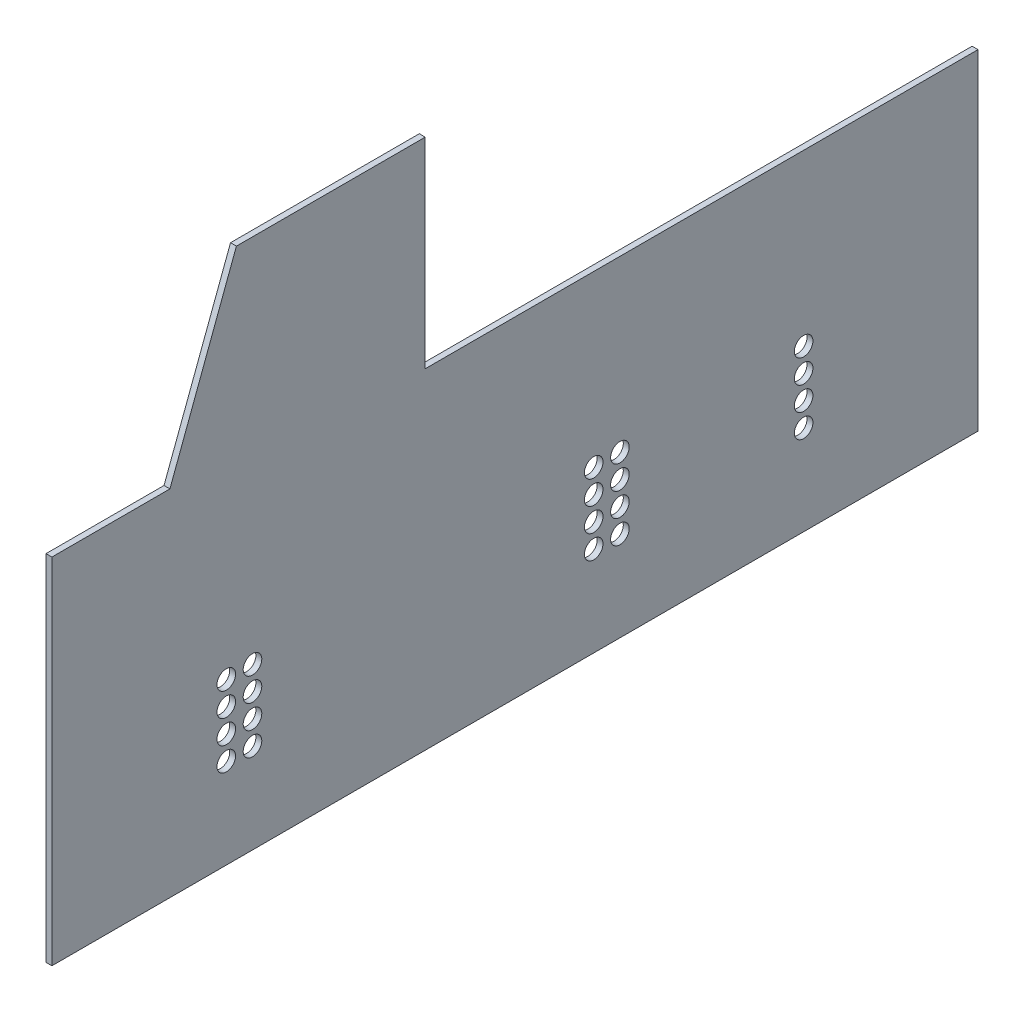
from build123d import *

# Parameters (mm, degrees)
SKETCH1_W                  = 498.348
SKETCH1_H                  = 177.8
BOSS_EXTRUDE1_DEPTH        = 1.5875
BOSS_EXTRUDE2_DEPTH        = 3.175
SKETCH3_R                  = 5
CUT_EXTRUDE3_DEPTH         = 318.565245896
LPATTERN3_COUNT            = 3
LPATTERN3_PITCH            = 12.7
LPATTERN3_COUNT_DIR2       = 2
LPATTERN3_PITCH_DIR2       = 12.7
LPATTERN4_COPY_1_SKETCH_R  = 5
LPATTERN4_COPY_1_DEPTH     = 318.565245896
LPATTERN4_COPY_2_SKETCH_R  = 5
LPATTERN4_COPY_2_DEPTH     = 318.565245896
LPATTERN4_COPY_3_SKETCH_R  = 5
LPATTERN4_COPY_3_DEPTH     = 318.565245896
LPATTERN4_COPY_4_SKETCH_R  = 5
LPATTERN4_COPY_4_DEPTH     = 318.565245896
LPATTERN4_COPY_5_SKETCH_R  = 5
LPATTERN4_COPY_5_DEPTH     = 318.565245896
LPATTERN4_COPY_6_SKETCH_R  = 5
LPATTERN4_COPY_6_DEPTH     = 318.565245896
SKETCH5_R                  = 5
CUT_EXTRUDE4_DEPTH         = 318.565245896
LPATTERN5_COUNT            = 3
LPATTERN5_PITCH            = 12.7
LPATTERN5_COUNT_DIR2       = 2
LPATTERN5_PITCH_DIR2       = 12.7
LPATTERN6_COPY_1_SKETCH_R  = 5
LPATTERN6_COPY_1_DEPTH     = 318.565245896
LPATTERN6_COPY_2_SKETCH_R  = 5
LPATTERN6_COPY_2_DEPTH     = 318.565245896
LPATTERN6_COPY_3_SKETCH_R  = 5
LPATTERN6_COPY_3_DEPTH     = 318.565245896
LPATTERN6_COPY_4_SKETCH_R  = 5
LPATTERN6_COPY_4_DEPTH     = 318.565245896
LPATTERN6_COPY_5_SKETCH_R  = 5
LPATTERN6_COPY_5_DEPTH     = 318.565245896
LPATTERN6_COPY_6_SKETCH_R  = 5
LPATTERN6_COPY_6_DEPTH     = 318.565245896
LPATTERN6_COPY_7_SKETCH_R  = 5
LPATTERN6_COPY_7_DEPTH     = 318.565245896
LPATTERN6_COPY_8_SKETCH_R  = 5
LPATTERN6_COPY_8_DEPTH     = 318.565245896
LPATTERN6_COPY_9_SKETCH_R  = 5
LPATTERN6_COPY_9_DEPTH     = 318.565245896
LPATTERN6_COPY_10_SKETCH_R = 5
LPATTERN6_COPY_10_DEPTH    = 318.565245896
LPATTERN6_COPY_11_SKETCH_R = 5
LPATTERN6_COPY_11_DEPTH    = 318.565245896
LPATTERN6_COPY_12_SKETCH_R = 5
LPATTERN6_COPY_12_DEPTH    = 318.565245896


with BuildPart() as part:
    # Sketch1 → Boss-Extrude1 (new, symmetric)
    with BuildSketch(Plane(origin=(0, 0, 0), x_dir=(0, 0, -1), z_dir=(1, 0, 0))):
        Rectangle(SKETCH1_W, SKETCH1_H)
    extrude(amount=BOSS_EXTRUDE1_DEPTH, both=True)

    # Sketch2 → Boss-Extrude2 (add)
    with BuildSketch(Plane.ZY.offset(1.5875)):
        Polygon((48.2854, 196.85), (48.2854, 88.9), (249.174, 88.9), (249.174, 101.6), (185.674, 101.6), (149.8854, 196.85), align=None)
    extrude(amount=-BOSS_EXTRUDE2_DEPTH)

    # Sketch3 → Cut-Extrude3 (cut, through all)
    with BuildSketch(Plane.ZY.offset(1.5875)):
        with Locations((155.3337, -27.7749)):
            Circle(SKETCH3_R)
    cut_extrude3 = extrude(amount=-CUT_EXTRUDE3_DEPTH, mode=Mode.SUBTRACT)

    # LPattern3: Cut-Extrude3 3 × 2
    with Locations(*[Vector(0, 1, 0) * (i * LPATTERN3_PITCH) + Vector(0, -1, 0) * (j * LPATTERN3_PITCH_DIR2) for i in range(LPATTERN3_COUNT) for j in range(LPATTERN3_COUNT_DIR2) if (i, j) != (0, 0)]):
        add(cut_extrude3, mode=Mode.SUBTRACT)

    # LPattern4 copy 1 sketch → LPattern4 copy 1 (cut, through all)
    with BuildSketch(Plane(origin=(-1.5875, -12.7, -197.7136), x_dir=(0, 0, 1), z_dir=(-1, 0, 0))):
        with Locations((155.3337, -27.7749)):
            Circle(LPATTERN4_COPY_1_SKETCH_R)
    extrude(amount=-LPATTERN4_COPY_1_DEPTH, mode=Mode.SUBTRACT)

    # LPattern4 copy 2 sketch → LPattern4 copy 2 (cut, through all)
    with BuildSketch(Plane(origin=(-1.5875, 12.7, -197.7136), x_dir=(0, 0, 1), z_dir=(-1, 0, 0))):
        with Locations((155.3337, -27.7749)):
            Circle(LPATTERN4_COPY_2_SKETCH_R)
    extrude(amount=-LPATTERN4_COPY_2_DEPTH, mode=Mode.SUBTRACT)

    # LPattern4 copy 3 sketch → LPattern4 copy 3 (cut, through all)
    with BuildSketch(Plane(origin=(-1.5875, 0, -197.7136), x_dir=(0, 0, 1), z_dir=(-1, 0, 0))):
        with Locations((155.3337, -27.7749)):
            Circle(LPATTERN4_COPY_3_SKETCH_R)
    extrude(amount=-LPATTERN4_COPY_3_DEPTH, mode=Mode.SUBTRACT)

    # LPattern4 copy 4 sketch → LPattern4 copy 4 (cut, through all)
    with BuildSketch(Plane(origin=(-1.5875, 25.4, -197.7136), x_dir=(0, 0, 1), z_dir=(-1, 0, 0))):
        with Locations((155.3337, -27.7749)):
            Circle(LPATTERN4_COPY_4_SKETCH_R)
    extrude(amount=-LPATTERN4_COPY_4_DEPTH, mode=Mode.SUBTRACT)

    # LPattern4 copy 5 sketch → LPattern4 copy 5 (cut, through all)
    with BuildSketch(Plane(origin=(-1.5875, 12.7, -197.7136), x_dir=(0, 0, 1), z_dir=(-1, 0, 0))):
        with Locations((155.3337, -27.7749)):
            Circle(LPATTERN4_COPY_5_SKETCH_R)
    extrude(amount=-LPATTERN4_COPY_5_DEPTH, mode=Mode.SUBTRACT)

    # LPattern4 copy 6 sketch → LPattern4 copy 6 (cut, through all)
    with BuildSketch(Plane(origin=(-1.5875, 0, -197.7136), x_dir=(0, 0, 1), z_dir=(-1, 0, 0))):
        with Locations((155.3337, -27.7749)):
            Circle(LPATTERN4_COPY_6_SKETCH_R)
    extrude(amount=-LPATTERN4_COPY_6_DEPTH, mode=Mode.SUBTRACT)

    # Sketch5 → Cut-Extrude4 (cut, through all)
    with BuildSketch(Plane.ZY.offset(1.5875)):
        with Locations((141.2367, -27.7749)):
            Circle(SKETCH5_R)
    cut_extrude4 = extrude(amount=-CUT_EXTRUDE4_DEPTH, mode=Mode.SUBTRACT)

    # LPattern5: Cut-Extrude4 3 × 2
    with Locations(*[Vector(0, 1, 0) * (i * LPATTERN5_PITCH) + Vector(0, -1, 0) * (j * LPATTERN5_PITCH_DIR2) for i in range(LPATTERN5_COUNT) for j in range(LPATTERN5_COUNT_DIR2) if (i, j) != (0, 0)]):
        add(cut_extrude4, mode=Mode.SUBTRACT)

    # LPattern6 copy 1 sketch → LPattern6 copy 1 (cut, through all)
    with BuildSketch(Plane(origin=(-1.5875, -12.7, -197.7136), x_dir=(0, 0, 1), z_dir=(-1, 0, 0))):
        with Locations((141.2367, -27.7749)):
            Circle(LPATTERN6_COPY_1_SKETCH_R)
    extrude(amount=-LPATTERN6_COPY_1_DEPTH, mode=Mode.SUBTRACT)

    # LPattern6 copy 2 sketch → LPattern6 copy 2 (cut, through all)
    with BuildSketch(Plane(origin=(-1.5875, -12.7, -296.5704), x_dir=(0, 0, 1), z_dir=(-1, 0, 0))):
        with Locations((141.2367, -27.7749)):
            Circle(LPATTERN6_COPY_2_SKETCH_R)
    extrude(amount=-LPATTERN6_COPY_2_DEPTH, mode=Mode.SUBTRACT)

    # LPattern6 copy 3 sketch → LPattern6 copy 3 (cut, through all)
    with BuildSketch(Plane(origin=(-1.5875, 12.7, -197.7136), x_dir=(0, 0, 1), z_dir=(-1, 0, 0))):
        with Locations((141.2367, -27.7749)):
            Circle(LPATTERN6_COPY_3_SKETCH_R)
    extrude(amount=-LPATTERN6_COPY_3_DEPTH, mode=Mode.SUBTRACT)

    # LPattern6 copy 4 sketch → LPattern6 copy 4 (cut, through all)
    with BuildSketch(Plane(origin=(-1.5875, 12.7, -296.5704), x_dir=(0, 0, 1), z_dir=(-1, 0, 0))):
        with Locations((141.2367, -27.7749)):
            Circle(LPATTERN6_COPY_4_SKETCH_R)
    extrude(amount=-LPATTERN6_COPY_4_DEPTH, mode=Mode.SUBTRACT)

    # LPattern6 copy 5 sketch → LPattern6 copy 5 (cut, through all)
    with BuildSketch(Plane(origin=(-1.5875, 0, -197.7136), x_dir=(0, 0, 1), z_dir=(-1, 0, 0))):
        with Locations((141.2367, -27.7749)):
            Circle(LPATTERN6_COPY_5_SKETCH_R)
    extrude(amount=-LPATTERN6_COPY_5_DEPTH, mode=Mode.SUBTRACT)

    # LPattern6 copy 6 sketch → LPattern6 copy 6 (cut, through all)
    with BuildSketch(Plane(origin=(-1.5875, 0, -296.5704), x_dir=(0, 0, 1), z_dir=(-1, 0, 0))):
        with Locations((141.2367, -27.7749)):
            Circle(LPATTERN6_COPY_6_SKETCH_R)
    extrude(amount=-LPATTERN6_COPY_6_DEPTH, mode=Mode.SUBTRACT)

    # LPattern6 copy 7 sketch → LPattern6 copy 7 (cut, through all)
    with BuildSketch(Plane(origin=(-1.5875, 25.4, -197.7136), x_dir=(0, 0, 1), z_dir=(-1, 0, 0))):
        with Locations((141.2367, -27.7749)):
            Circle(LPATTERN6_COPY_7_SKETCH_R)
    extrude(amount=-LPATTERN6_COPY_7_DEPTH, mode=Mode.SUBTRACT)

    # LPattern6 copy 8 sketch → LPattern6 copy 8 (cut, through all)
    with BuildSketch(Plane(origin=(-1.5875, 25.4, -296.5704), x_dir=(0, 0, 1), z_dir=(-1, 0, 0))):
        with Locations((141.2367, -27.7749)):
            Circle(LPATTERN6_COPY_8_SKETCH_R)
    extrude(amount=-LPATTERN6_COPY_8_DEPTH, mode=Mode.SUBTRACT)

    # LPattern6 copy 9 sketch → LPattern6 copy 9 (cut, through all)
    with BuildSketch(Plane(origin=(-1.5875, 12.7, -197.7136), x_dir=(0, 0, 1), z_dir=(-1, 0, 0))):
        with Locations((141.2367, -27.7749)):
            Circle(LPATTERN6_COPY_9_SKETCH_R)
    extrude(amount=-LPATTERN6_COPY_9_DEPTH, mode=Mode.SUBTRACT)

    # LPattern6 copy 10 sketch → LPattern6 copy 10 (cut, through all)
    with BuildSketch(Plane(origin=(-1.5875, 12.7, -296.5704), x_dir=(0, 0, 1), z_dir=(-1, 0, 0))):
        with Locations((141.2367, -27.7749)):
            Circle(LPATTERN6_COPY_10_SKETCH_R)
    extrude(amount=-LPATTERN6_COPY_10_DEPTH, mode=Mode.SUBTRACT)

    # LPattern6 copy 11 sketch → LPattern6 copy 11 (cut, through all)
    with BuildSketch(Plane(origin=(-1.5875, 0, -197.7136), x_dir=(0, 0, 1), z_dir=(-1, 0, 0))):
        with Locations((141.2367, -27.7749)):
            Circle(LPATTERN6_COPY_11_SKETCH_R)
    extrude(amount=-LPATTERN6_COPY_11_DEPTH, mode=Mode.SUBTRACT)

    # LPattern6 copy 12 sketch → LPattern6 copy 12 (cut, through all)
    with BuildSketch(Plane(origin=(-1.5875, 0, -296.5704), x_dir=(0, 0, 1), z_dir=(-1, 0, 0))):
        with Locations((141.2367, -27.7749)):
            Circle(LPATTERN6_COPY_12_SKETCH_R)
    extrude(amount=-LPATTERN6_COPY_12_DEPTH, mode=Mode.SUBTRACT)


solid = part.part
